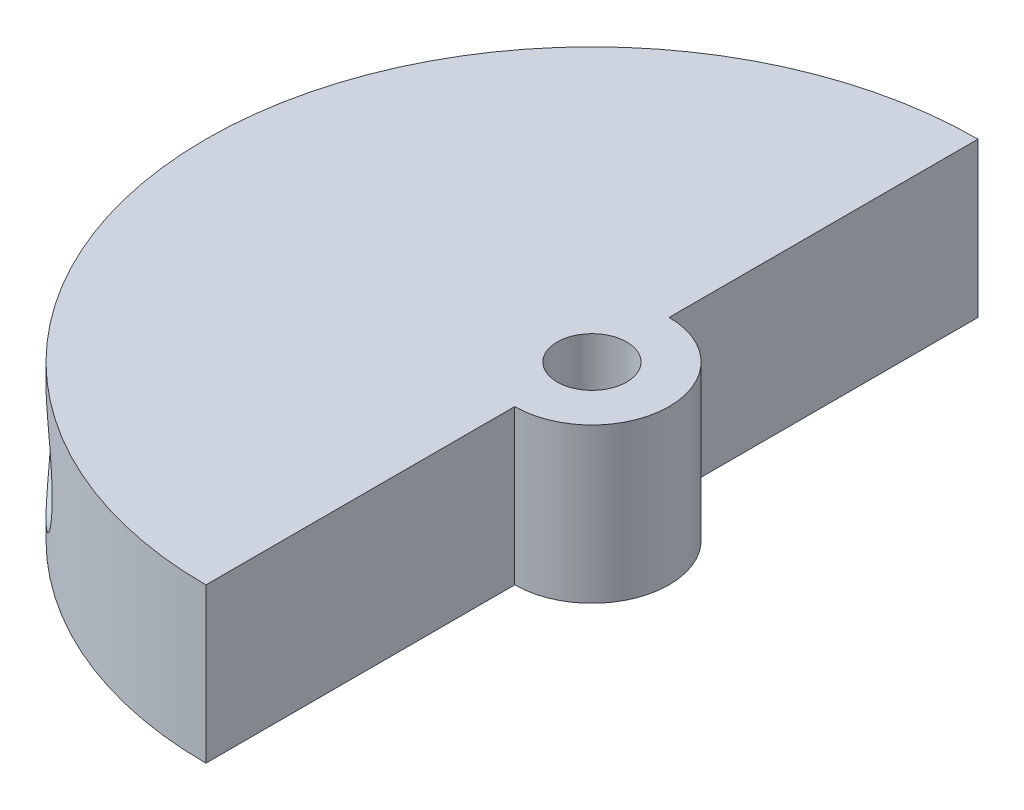
from build123d import *

# Parameters (mm, degrees)
CROQUIS1_R              = 0.9
SALIENTE_EXTRUIR1_DEPTH = 4
CROQUIS5_R              = 1.5
CORTAR_EXTRUIR1_DEPTH   = 6
CROQUIS6_R              = 1.5
CORTAR_EXTRUIR2_DEPTH   = 6
CROQUIS7_R              = 1.5
CORTAR_EXTRUIR3_DEPTH   = 6


with BuildPart() as part:
    # Croquis1 → Saliente-Extruir1 (new body)
    with BuildSketch(Plane(origin=(0, 0, 0), x_dir=(1, 0, 0), z_dir=(0, 1, 0))):
        with BuildLine():
            Line((0, 2), (0, 10))
            ThreePointArc((0, 10), (-10, 0), (0, -10))
            Line((0, -10), (0, -2))
            ThreePointArc((0, -2), (2, 0), (0, 2))
        make_face()
        Circle(CROQUIS1_R, mode=Mode.SUBTRACT)
    extrude(amount=SALIENTE_EXTRUIR1_DEPTH)

    # Croquis5 → Cortar-Extruir1 (cut)
    with BuildSketch(Plane(origin=(-7.071067812, 0, -7.071067812), x_dir=(0, -1, 0), z_dir=(-0.7071067811865464, 0, -0.7071067811865488))):
        with Locations((-2, 0)):
            Circle(CROQUIS5_R)
    extrude(amount=-CORTAR_EXTRUIR1_DEPTH, mode=Mode.SUBTRACT)

    # Croquis6 → Cortar-Extruir2 (cut)
    with BuildSketch(Plane.ZY.offset(10)):
        with Locations((0, 2)):
            Circle(CROQUIS6_R)
    extrude(amount=-CORTAR_EXTRUIR2_DEPTH, mode=Mode.SUBTRACT)

    # Croquis7 → Cortar-Extruir3 (cut)
    with BuildSketch(Plane(origin=(-7.071067812, 0, 7.071067812), x_dir=(0, -1, 0), z_dir=(-0.7071067811865512, 0, 0.7071067811865438))):
        with Locations((-2, 0)):
            Circle(CROQUIS7_R)
    extrude(amount=-CORTAR_EXTRUIR3_DEPTH, mode=Mode.SUBTRACT)


solid = part.part
